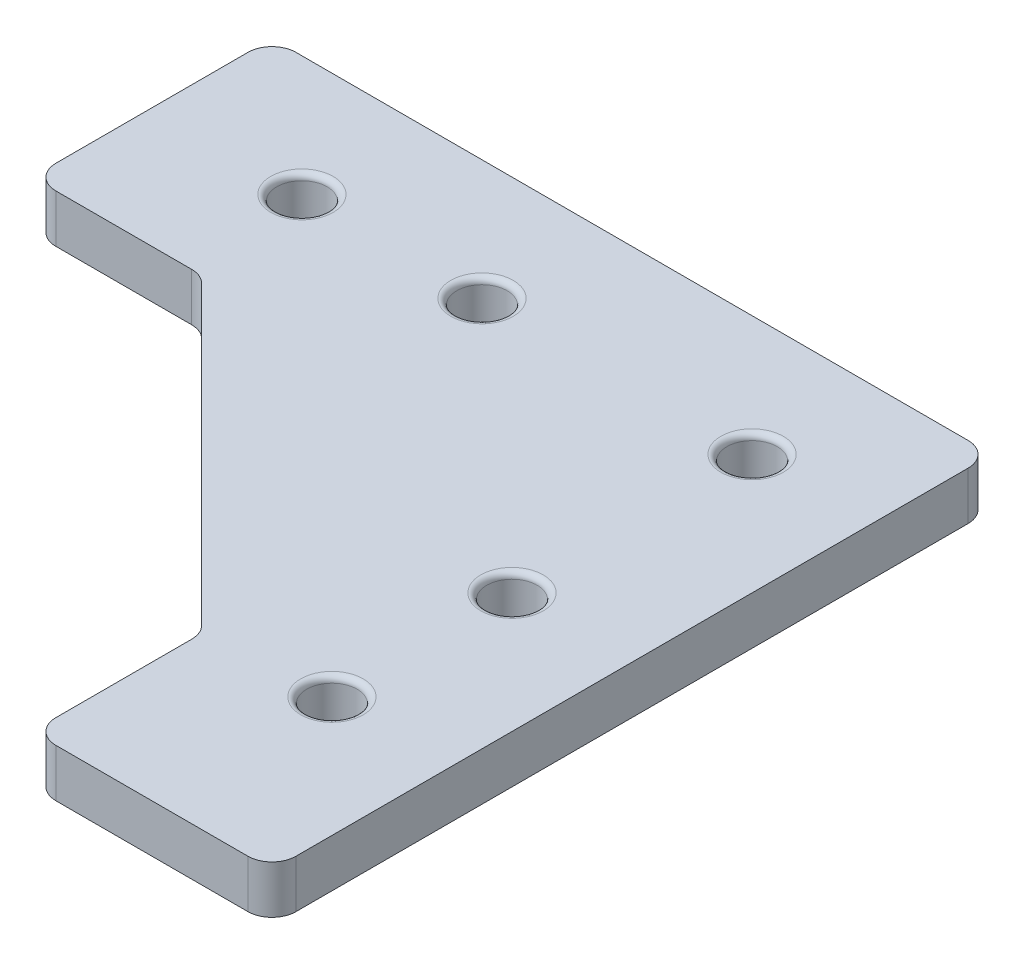
from build123d import *

# Parameters (mm, degrees)
STOCK_MASTER_SKETCH_002_1_START     = -60
STOCK_MASTER_SKETCH_002_1_OUTLINE_R = 2.1
STOCK_MASTER_SKETCH_002_1_DEPTH     = 4
FILLET1_R                           = 2
FILLET2_R                           = 0.5


# Read off the part's stored shape, not the designer's step: Stock-master_sketch_002-1
with BuildPart() as part:
    # Stock-master_sketch_002-1 outline → Stock-master_sketch_002-1 (new body)
    with BuildSketch(Plane(origin=(0, 0, 0), x_dir=(1, 0, 0), z_dir=(0, 1, 0)).offset(STOCK_MASTER_SKETCH_002_1_START)):
        Polygon((410, -1790), (410, -1730), (350, -1730), (350, -1750), (364.142135624, -1750), (390, -1775.857864376), (390, -1790), align=None)
        with Locations((400, -1775)):
            Circle(STOCK_MASTER_SKETCH_002_1_OUTLINE_R, mode=Mode.SUBTRACT)
        with Locations((362.5, -1740)):
            Circle(STOCK_MASTER_SKETCH_002_1_OUTLINE_R, mode=Mode.SUBTRACT)
        with Locations((377.5, -1740)):
            Circle(STOCK_MASTER_SKETCH_002_1_OUTLINE_R, mode=Mode.SUBTRACT)
        with Locations((400, -1760)):
            Circle(STOCK_MASTER_SKETCH_002_1_OUTLINE_R, mode=Mode.SUBTRACT)
        with Locations((400, -1740)):
            Circle(STOCK_MASTER_SKETCH_002_1_OUTLINE_R, mode=Mode.SUBTRACT)
    extrude(amount=STOCK_MASTER_SKETCH_002_1_DEPTH)

    # Fillet1
    fillet1_edges = [part.edges().sort_by_distance(p)[0] for p in [
        (410, -58, 1790),
        (390, -58, 1790),
        (390, -58, 1775.857864376),
        (364.142135624, -58, 1750),
        (350, -58, 1750),
        (350, -58, 1730),
        (410, -58, 1730),
    ]]
    fillet(fillet1_edges, radius=FILLET1_R)

    # Fillet2
    fillet2_edges = [part.edges().sort_by_distance(p)[0] for p in [
        (397.9, -56, 1775),
        (397.9, -56, 1760),
        (375.4, -60, 1740),
        (360.4, -60, 1740),
        (397.9, -56, 1740),
        (397.9, -60, 1740),
        (397.9, -60, 1760),
        (397.9, -60, 1775),
        (360.4, -56, 1740),
        (375.4, -56, 1740),
    ]]
    fillet(fillet2_edges, radius=FILLET2_R)


solid = part.part
